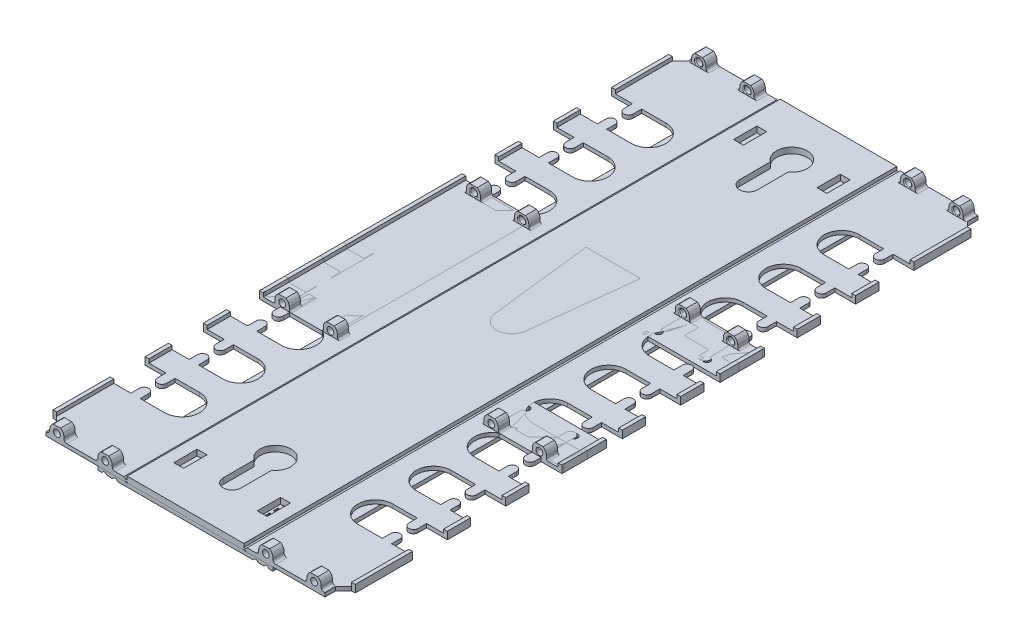
from build123d import *

# Parameters (mm, degrees)
BOSS_EXTRUDE1_DEPTH      = 88.9
SKETCH68_R               = 0.925000055
BOSS_EXTRUDE26_DEPTH     = 3.048
FILLET2_R                = 0.762
FILLET3_R                = 0.254
CUT_EXTRUDE38_DEPTH      = 99.000889576
CUT_EXTRUDE38_DEPTH_BACK = 99.000889576
CUT_EXTRUDE20_DEPTH      = 98.986261425
CUT_EXTRUDE20_DEPTH_BACK = 98.986261425
CUT_EXTRUDE34_DEPTH      = 98.986261425
CUT_EXTRUDE34_DEPTH_BACK = 98.986261425
SKETCH75_R               = 4.191
SKETCH75_W               = 2.6690574
SKETCH75_H               = 6.35
LID_HALF_DEPTH           = 88.9
LID_HALF_DEPTH_BACK      = 88.9
LOGOTEXTSKETCH_W         = 3.793924051
LOGOTEXTSKETCH_H         = 1.221772152
LOGOTEXTSKETCH_W_2       = 0.900253164
LOGOTEXTSKETCH_H_2       = 1.350379746
LOGOTEXTSKETCH_W_3       = 5.272911392
LOGOTEXTSKETCH_H_3       = 1.350379747
CUT_EXTRUDE41_DEPTH      = 0.3048
CUT_EXTRUDE28_DEPTH      = 0.3048
BOSS_EXTRUDE19_DEPTH     = 27.559
SKETCH72_R               = 0.925000055
BOSS_EXTRUDE29_DEPTH     = 3.048
FILLET4_R                = 0.508
FILLET5_R                = 0.254
CUT_EXTRUDE33_DEPTH      = 99.000889576
CUT_EXTRUDE33_DEPTH_BACK = 99.000889576
SKETCH73_R               = 0.925000055
SKETCH73_W               = 29.464
SKETCH73_H               = 30.960000056


with BuildPart() as part:
    # FingerSketch → Boss-Extrude1 (new body)
    with BuildSketch(Plane.XY):
        Polygon((0, 0), (15.748, 0), (15.875, 0.127), (16.383, 0.127), (16.51, 0), (41.148, 0), (41.148, 1.258244922), (41.148, 2.032), (40.132, 2.032), (40.132, 1.016), (16.764, 1.016), (16.383, 0.635), (15.875, 0.635), (15.875, 1.5875), (0, 1.5875), align=None)
    extrude(amount=-BOSS_EXTRUDE1_DEPTH)

    # Sketch68 → Boss-Extrude26 (add)
    # profile 1 of 2: a face of its own
    with BuildSketch(Plane(origin=(0, 0, -88.9), x_dir=(-1, 0, 0), z_dir=(0, 0, -1))):
        with BuildLine():
            Line((-19.939, 1.016), (-19.939, 2.145000028))
            ThreePointArc((-19.939, 2.145000028), (-20.191232451, 3.101841286), (-20.882374721, 3.81))
            Line((-20.882374721, 3.81), (-22.877625389, 3.81))
            ThreePointArc((-22.877625389, 3.81), (-23.568767659, 3.101841286), (-23.82100011, 2.145000028))
            Line((-23.82100011, 2.145000028), (-23.82100011, 1.016))
            Line((-23.82100011, 1.016), (-19.939, 1.016))
        make_face()
        with Locations((-21.880000055, 2.145000028)):
            Circle(SKETCH68_R, mode=Mode.SUBTRACT)
    # profile 2 of 2: a face of its own
    with BuildSketch(Plane(origin=(0, 0, -88.9), x_dir=(-1, 0, 0), z_dir=(0, 0, -1))):
        with BuildLine():
            Line((-34.018374611, 3.81), (-36.013625279, 3.81))
            ThreePointArc((-36.013625279, 3.81), (-36.704767549, 3.101841286), (-36.957, 2.145000028))
            Line((-36.957, 2.145000028), (-36.957, 1.016))
            Line((-36.957, 1.016), (-33.07499989, 1.016))
            Line((-33.07499989, 1.016), (-33.07499989, 2.145000028))
            ThreePointArc((-33.07499989, 2.145000028), (-33.327232341, 3.101841286), (-34.018374611, 3.81))
        make_face()
        with Locations((-35.015999945, 2.145000028)):
            Circle(SKETCH68_R, mode=Mode.SUBTRACT)
    extrude(amount=-BOSS_EXTRUDE26_DEPTH)

    # Fillet2
    fillet2_edges = [part.edges().sort_by_distance(p)[0] for p in [
        (19.939, 1.016, -87.376),
        (23.82100011, 1.016, -87.376),
        (33.07499989, 1.016, -87.376),
        (36.957, 1.016, -87.376),
    ]]
    fillet(fillet2_edges, radius=FILLET2_R)

    # Fillet3
    fillet3_edges = [part.edges().sort_by_distance(p)[0] for p in [
        (22.80500011, 2.145000028, -85.852),
        (35.941, 2.145000028, -85.852),
    ]]
    fillet(fillet3_edges, radius=FILLET3_R)

    # Sketch79 → Cut-Extrude38 (cut, two sides: drawn at the far end of the back side and taken through both)
    with BuildSketch(Plane(origin=(0, 1.016, 0), x_dir=(1, 0, 0), z_dir=(0, 1, 0)).offset(-CUT_EXTRUDE38_DEPTH_BACK)):
        Polygon((37.973, 85.979), (40.132, 83.82), (41.148, 83.82), (41.148, 88.9), (37.973, 88.9), align=None)
    extrude(amount=CUT_EXTRUDE38_DEPTH + CUT_EXTRUDE38_DEPTH_BACK, mode=Mode.SUBTRACT)

    # Sketch4 → Cut-Extrude20 (cut, two sides: drawn at the far end of the back side and taken through both)
    with BuildSketch(Plane(origin=(0, 1.5875, 0), x_dir=(1, 0, 0), z_dir=(0, 1, 0)).offset(-CUT_EXTRUDE20_DEPTH_BACK)):
        with BuildLine():
            Line((26.289, 4.7625), (32.9565, 4.7625))
            Line((32.9565, 4.7625), (32.9565, 2.460625))
            ThreePointArc((32.9565, 2.460625), (34.2265, 1.190625), (35.4965, 2.460625))
            Line((35.4965, 2.460625), (35.4965, 4.7625))
            Line((35.4965, 4.7625), (77.089, 4.7625))
            Line((77.089, 4.7625), (77.089, -4.7625))
            Line((77.089, -4.7625), (35.4965, -4.7625))
            Line((35.4965, -4.7625), (35.4965, -2.460625))
            ThreePointArc((35.4965, -2.460625), (34.2265, -1.190625), (32.9565, -2.460625))
            Line((32.9565, -2.460625), (32.9565, -4.7625))
            Line((32.9565, -4.7625), (26.289, -4.7625))
            ThreePointArc((26.289, -4.7625), (21.5265, 0), (26.289, 4.7625))
        make_face()
        with BuildLine():
            Line((26.289, 20.6375), (32.9565, 20.6375))
            Line((32.9565, 20.6375), (32.9565, 18.335625))
            ThreePointArc((32.9565, 18.335625), (34.2265, 17.065625), (35.4965, 18.335625))
            Line((35.4965, 18.335625), (35.4965, 20.6375))
            Line((35.4965, 20.6375), (77.089, 20.6375))
            Line((77.089, 20.6375), (77.089, 11.1125))
            Line((77.089, 11.1125), (35.4965, 11.1125))
            Line((35.4965, 11.1125), (35.4965, 13.414375))
            ThreePointArc((35.4965, 13.414375), (34.2265, 14.684375), (32.9565, 13.414375))
            Line((32.9565, 13.414375), (32.9565, 11.1125))
            Line((32.9565, 11.1125), (26.289, 11.1125))
            ThreePointArc((26.289, 11.1125), (21.5265, 15.875), (26.289, 20.6375))
        make_face()
        with BuildLine():
            Line((26.289, 36.5125), (32.9565, 36.5125))
            Line((32.9565, 36.5125), (32.9565, 34.210625))
            ThreePointArc((32.9565, 34.210625), (34.2265, 32.940625), (35.4965, 34.210625))
            Line((35.4965, 34.210625), (35.4965, 36.5125))
            Line((35.4965, 36.5125), (77.089, 36.5125))
            Line((77.089, 36.5125), (77.089, 26.9875))
            Line((77.089, 26.9875), (35.4965, 26.9875))
            Line((35.4965, 26.9875), (35.4965, 29.289375))
            ThreePointArc((35.4965, 29.289375), (34.2265, 30.559375), (32.9565, 29.289375))
            Line((32.9565, 29.289375), (32.9565, 26.9875))
            Line((32.9565, 26.9875), (26.289, 26.9875))
            ThreePointArc((26.289, 26.9875), (21.5265, 31.75), (26.289, 36.5125))
        make_face()
        with BuildLine():
            Line((26.289, 52.3875), (32.9565, 52.3875))
            Line((32.9565, 52.3875), (32.9565, 50.085625))
            ThreePointArc((32.9565, 50.085625), (34.2265, 48.815625), (35.4965, 50.085625))
            Line((35.4965, 50.085625), (35.4965, 52.3875))
            Line((35.4965, 52.3875), (77.089, 52.3875))
            Line((77.089, 52.3875), (77.089, 42.8625))
            Line((77.089, 42.8625), (35.4965, 42.8625))
            Line((35.4965, 42.8625), (35.4965, 45.164375))
            ThreePointArc((35.4965, 45.164375), (34.2265, 46.434375), (32.9565, 45.164375))
            Line((32.9565, 45.164375), (32.9565, 42.8625))
            Line((32.9565, 42.8625), (26.289, 42.8625))
            ThreePointArc((26.289, 42.8625), (21.5265, 47.625), (26.289, 52.3875))
        make_face()
        with BuildLine():
            Line((26.289, 68.2625), (32.9565, 68.2625))
            Line((32.9565, 68.2625), (32.9565, 65.960625))
            ThreePointArc((32.9565, 65.960625), (34.2265, 64.690625), (35.4965, 65.960625))
            Line((35.4965, 65.960625), (35.4965, 68.2625))
            Line((35.4965, 68.2625), (77.089, 68.2625))
            Line((77.089, 68.2625), (77.089, 58.7375))
            Line((77.089, 58.7375), (35.4965, 58.7375))
            Line((35.4965, 58.7375), (35.4965, 61.039375))
            ThreePointArc((35.4965, 61.039375), (34.2265, 62.309375), (32.9565, 61.039375))
            Line((32.9565, 61.039375), (32.9565, 58.7375))
            Line((32.9565, 58.7375), (26.289, 58.7375))
            ThreePointArc((26.289, 58.7375), (21.5265, 63.5), (26.289, 68.2625))
        make_face()
    extrude(amount=CUT_EXTRUDE20_DEPTH + CUT_EXTRUDE20_DEPTH_BACK, mode=Mode.SUBTRACT)

    # Mirror31: part across plane


with BuildPart() as part_1:
    add(part.part)
    add(part.part.mirror(Plane.XY))

    # Mirror32: part across plane


with BuildPart() as part_2:
    add(part_1.part)
    add(part_1.part.mirror(Plane(origin=(0, 1.5875, -88.9), x_dir=(0, 0, 1), z_dir=(-1, 0, 0))))

    # Sketch75 → Cut-Extrude34 (cut, two sides: drawn at the far end of the back side and taken through both)
    with BuildSketch(Plane(origin=(0, 1.5875, 0), x_dir=(1, 0, 0), z_dir=(0, 1, 0)).offset(-CUT_EXTRUDE34_DEPTH_BACK)):
        Circle(SKETCH75_R)
        with BuildLine():
            Line((2.413, -76.2), (2.413, -67.818))
            ThreePointArc((2.413, -67.818), (0, -60.200352659), (-2.413, -67.818))
            Line((-2.413, -67.818), (-2.413, -76.2))
            ThreePointArc((-2.413, -76.2), (0, -78.613), (2.413, -76.2))
        make_face()
        with BuildLine():
            Line((2.413, 64.391352659), (2.413, 72.773352659))
            ThreePointArc((2.413, 72.773352659), (0, 80.391), (-2.413, 72.773352659))
            Line((-2.413, 72.773352659), (-2.413, 64.391352659))
            ThreePointArc((-2.413, 64.391352659), (0, 61.978352659), (2.413, 64.391352659))
        make_face()
        with Locations((-11.3654713, 76.2)):
            Rectangle(SKETCH75_W, SKETCH75_H)
        with Locations((11.3654713, 76.2)):
            Rectangle(SKETCH75_W, SKETCH75_H)
        with Locations((11.3654713, -76.2)):
            Rectangle(SKETCH75_W, SKETCH75_H)
        with Locations((-11.3654713, -76.2)):
            Rectangle(SKETCH75_W, SKETCH75_H)
    extrude(amount=CUT_EXTRUDE34_DEPTH + CUT_EXTRUDE34_DEPTH_BACK, mode=Mode.SUBTRACT)


with BuildPart() as body_2:
    # LidSketch → Lid-Half (new, two sides: drawn at the far end of the back side and taken through both)
    with BuildSketch(Plane.XY.offset(-LID_HALF_DEPTH_BACK)):
        Polygon((0, 0), (23.7998, 0), (23.7998, -1.016), (22.7838, -1.016), (22.2758, -0.508), (21.8694, -0.508), (21.3614, -1.016), (19.8374, -1.016), (19.3294, -0.508), (18.923, -0.508), (18.415, -1.016), (0, -1.016), align=None)
    extrude(amount=LID_HALF_DEPTH + LID_HALF_DEPTH_BACK)

    # Mirror25: body 2 across plane


with BuildPart() as body_2_1:
    add(body_2.part)
    add(body_2.part.mirror(Plane(origin=(0, -1.016, -88.9), x_dir=(0, 0, 1), z_dir=(-1, 0, 0))))

    # LogoTextSketch → Cut-Extrude41 (cut)
    # profile 1 of 14: a face of its own
    with BuildSketch(Plane(origin=(0, 0, 0), x_dir=(1, 0, 0), z_dir=(0, 1, 0))):
        Polygon((10.795, -78.611392405), (15.875, -80.454098101), (15.875, -81.912990506), (10.795, -83.755696203), (10.795, -82.387231013), (14.40806962, -81.149382911), (10.795, -79.91153481), align=None)
    # profile 2 of 14: a face of its own
    with BuildSketch(Plane(origin=(0, 0, 0), x_dir=(1, 0, 0), z_dir=(0, 1, 0))):
        with Locations((13.978037975, -77.293164557)):
            Rectangle(LOGOTEXTSKETCH_W, LOGOTEXTSKETCH_H)
    # profile 3 of 14: a face of its own
    with BuildSketch(Plane(origin=(0, 0, 0), x_dir=(1, 0, 0), z_dir=(0, 1, 0))):
        with Locations((11.05221519, -77.293164557)):
            Rectangle(LOGOTEXTSKETCH_W_2, LOGOTEXTSKETCH_H_2)
    # profile 4 of 14: a face of its own
    with BuildSketch(Plane(origin=(0, 0, 0), x_dir=(1, 0, 0), z_dir=(0, 1, 0))):
        with Locations((13.238544304, -74.913924051)):
            Rectangle(LOGOTEXTSKETCH_W_3, LOGOTEXTSKETCH_H)
    # profile 5 of 14: a face of its own
    with BuildSketch(Plane(origin=(0, 0, 0), x_dir=(1, 0, 0), z_dir=(0, 1, 0))):
        with Locations((13.238544304, -72.534683544)):
            Rectangle(LOGOTEXTSKETCH_W_3, LOGOTEXTSKETCH_H)
    # profile 6 of 14: a face of its own
    with BuildSketch(Plane(origin=(0, 0, 0), x_dir=(1, 0, 0), z_dir=(0, 1, 0))):
        with BuildLine():
            add(Edge.make_bspline(
                [(15.471091772, -68.451392405), (15.498614467, -68.487858085), (15.559190151, -68.568116703), (15.652438813, -68.694367961), (15.745244088, -68.827171113), (15.794508188, -68.922087513), (15.81772943, -68.966827532)],
                knots=[0, 0, 0, 0, 0.881141738, 1.939336363, 3.028680722, 4, 4, 4, 4], degree=3))
            add(Edge.make_bspline(
                [(15.81772943, -68.966827532), (15.845233424, -69.026555013), (15.90032134, -69.146183549), (15.948607766, -69.30474509), (15.976485245, -69.435869622), (15.993100434, -69.538723702), (16.001874183, -69.646550388), (16.003021663, -69.720038483), (16.003607595, -69.757563291)],
                knots=[0, 0, 0, 0, 1.44279282, 2.889778507, 3.626899602, 4.386250432, 5.175980226, 6, 6, 6, 6], degree=3))
            add(Edge.make_bspline(
                [(16.003607595, -69.757563291), (16.002750455, -69.801488718), (16.001062874, -69.887971309), (15.984492599, -70.015107561), (15.957718476, -70.136573074), (15.919709208, -70.252356945), (15.873298304, -70.363548759), (15.812880868, -70.468116032), (15.743749724, -70.568019165), (15.664302339, -70.660827732), (15.577987714, -70.746673503), (15.482419999, -70.819399629), (15.383364601, -70.884197416), (15.276241026, -70.933800305), (15.16462257, -70.974917076), (15.046458559, -71.002314607), (14.92270707, -71.020141499), (14.838166185, -71.022392311), (14.794897152, -71.023544304)],
                knots=[0, 0, 0, 0, 1.076358544, 2.119188901, 3.137092131, 4.121153932, 5.103295744, 6.085025642, 7.075812122, 8.077694892, 9.076342729, 10.053530105, 11.016996406, 11.971853096, 12.940587616, 13.928341713, 14.939700582, 16, 16, 16, 16], degree=3))
            add(Edge.make_bspline(
                [(14.794897152, -71.023544304), (14.760375748, -71.023031806), (14.693218098, -71.022034797), (14.594971407, -71.012359162), (14.501240594, -70.998730988), (14.41213198, -70.978912894), (14.327828842, -70.952525931), (14.248670006, -70.920321), (14.173700942, -70.883331881), (14.081031733, -70.82520985), (13.974702488, -70.738319051), (13.86105285, -70.615301335), (13.761884983, -70.472730962), (13.709459895, -70.367181159), (13.682642405, -70.313188291)],
                knots=[0, 0, 0, 0, 0.88291446, 1.717614387, 2.523449501, 3.305050364, 4.050299936, 4.780623104, 5.489521503, 6.186144807, 7.575169446, 8.987908457, 10.459196939, 12, 12, 12, 12], degree=3))
            add(Edge.make_bspline(
                [(13.682642405, -70.313188291), (13.657799828, -70.253964254), (13.60626134, -70.131097879), (13.547208407, -69.931294794), (13.498036942, -69.712086301), (13.448977132, -69.38991438), (13.403708541, -68.965281802), (13.379473663, -68.619941112), (13.367151899, -68.444359177)],
                knots=[0, 0, 0, 0, 0.606561714, 1.258374848, 1.96559256, 2.728439316, 4.336636913, 6, 6, 6, 6], degree=3))
            Line((13.367151899, -68.444359177), (13.347056962, -68.444359177))
            add(Edge.make_bspline(
                [(13.347056962, -68.444359177), (13.32154498, -68.445039977), (13.272555629, -68.446347282), (13.202031393, -68.458886832), (13.137492648, -68.478381742), (13.079152372, -68.507367456), (13.026345234, -68.543228865), (12.980747868, -68.588843825), (12.939990884, -68.641032252), (12.907124676, -68.702613035), (12.879273701, -68.771187237), (12.855546056, -68.846968902), (12.833983175, -68.92999437), (12.81748491, -69.021042615), (12.804386314, -69.119621265), (12.795845742, -69.225606143), (12.789386844, -69.339175159), (12.788747908, -69.417613589), (12.788417722, -69.458148734)],
                knots=[0, 0, 0, 0, 0.933170865, 1.791920174, 2.614087183, 3.392770743, 4.168261972, 4.939963421, 5.744383729, 6.584011918, 7.485718493, 8.451275145, 9.489173902, 10.624282219, 11.836444718, 13.128632794, 14.516144596, 16, 16, 16, 16], degree=3))
            add(Edge.make_bspline(
                [(12.788417722, -69.458148734), (12.789575831, -69.509109483), (12.791945495, -69.613382707), (12.811939061, -69.77194583), (12.84462443, -69.935569553), (12.887872377, -70.098812379), (12.935830948, -70.251548952), (12.976523722, -70.386216582), (13.01243626, -70.496407428), (13.035483295, -70.561730835), (13.045632911, -70.590498418)],
                knots=[0, 0, 0, 0, 1.048023305, 2.144410588, 3.282079539, 4.478558128, 5.616227078, 6.575084586, 7.372485689, 8, 8, 8, 8], degree=3))
            Line((13.045632911, -70.590498418), (13.045632911, -70.702025316))
            Line((13.045632911, -70.702025316), (12.139351266, -70.702025316))
            add(Edge.make_bspline(
                [(12.139351266, -70.702025316), (12.130387793, -70.664570531), (12.110217608, -70.580287348), (12.082929968, -70.437652176), (12.051709585, -70.265231856), (12.019368047, -70.067401376), (11.988834071, -69.854249993), (11.968569783, -69.635609752), (11.954466255, -69.416805036), (11.953134981, -69.270953527), (11.952468354, -69.197919304)],
                knots=[0, 0, 0, 0, 0.6084796, 1.369240178, 2.294152062, 3.377333042, 4.536647214, 5.695671455, 6.846122025, 8, 8, 8, 8], degree=3))
            add(Edge.make_bspline(
                [(11.952468354, -69.197919304), (11.953370641, -69.114167135), (11.95511543, -68.952211997), (11.970161702, -68.718469188), (11.994857066, -68.502754811), (12.029412156, -68.3052476), (12.074881809, -68.125749205), (12.12774632, -67.963215463), (12.193399083, -67.819449208), (12.269037916, -67.692877861), (12.356608344, -67.583132604), (12.454433097, -67.487654992), (12.564506967, -67.40743234), (12.685770341, -67.34177726), (12.818759838, -67.291633979), (12.962697977, -67.25568361), (13.117930472, -67.233074594), (13.225401959, -67.230794416), (13.280743671, -67.229620253)],
                knots=[0, 0, 0, 0, 1.479899489, 2.861744692, 4.136898628, 5.315257758, 6.401879285, 7.406912486, 8.331189956, 9.188870103, 10.005954314, 10.805378538, 11.597319, 12.405025375, 13.234891758, 14.101894016, 15.022583225, 16, 16, 16, 16], degree=3))
            Line((13.280743671, -67.229620253), (15.875, -67.229620253))
            Line((15.875, -67.229620253), (15.875, -68.451392405))
            Line((15.875, -68.451392405), (15.471091772, -68.451392405))
        make_face()
        with BuildLine():
            Line((14.889343354, -68.451392405), (14.074493671, -68.451392405))
            add(Edge.make_bspline(
                [(14.074493671, -68.451392405), (14.082584256, -68.537495036), (14.099411798, -68.716579207), (14.125104728, -68.940646483), (14.148965673, -69.117949351), (14.170386107, -69.235794696), (14.191595528, -69.336605887), (14.209148421, -69.397274657), (14.217167722, -69.424992089)],
                knots=[0, 0, 0, 0, 1.57964772, 3.285496648, 4.119513749, 4.84671241, 5.47310339, 6, 6, 6, 6], degree=3))
            add(Edge.make_bspline(
                [(14.217167722, -69.424992089), (14.22754035, -69.454079193), (14.247432046, -69.50985983), (14.287168287, -69.586234004), (14.332927957, -69.652335841), (14.387300974, -69.706825272), (14.449605162, -69.750205249), (14.521165001, -69.780154192), (14.601371539, -69.798845047), (14.657805004, -69.800765427), (14.687389241, -69.801772152)],
                knots=[0, 0, 0, 0, 1.134226965, 2.175118677, 3.155630695, 4.078552511, 4.990484312, 5.928236403, 6.913914931, 8, 8, 8, 8], degree=3))
            add(Edge.make_bspline(
                [(14.687389241, -69.801772152), (14.724243766, -69.800843371), (14.790646432, -69.799169941), (14.884702408, -69.786485888), (14.967988261, -69.747352454), (15.009615514, -69.703039989), (15.032017405, -69.679193038)],
                knots=[0, 0, 0, 0, 1.163598059, 2.096513573, 2.975630291, 4, 4, 4, 4], degree=3))
            add(Edge.make_bspline(
                [(15.032017405, -69.679193038), (15.053410379, -69.651548475), (15.097104887, -69.595085284), (15.132764622, -69.508348872), (15.150190808, -69.426478405), (15.161328766, -69.348970773), (15.166592869, -69.256266747), (15.167285919, -69.189550629), (15.167658228, -69.153710443)],
                knots=[0, 0, 0, 0, 1.128733193, 2.305403657, 2.994957252, 3.838787388, 4.838987289, 6, 6, 6, 6], degree=3))
            add(Edge.make_bspline(
                [(15.167658228, -69.153710443), (15.16658297, -69.123185725), (15.164409779, -69.061492598), (15.149929517, -68.968514057), (15.125533307, -68.875146915), (15.09246664, -68.782068526), (15.051348527, -68.691596782), (15.004843589, -68.604839303), (14.94986926, -68.52520931), (14.909444264, -68.475907312), (14.889343354, -68.451392405)],
                knots=[0, 0, 0, 0, 0.950493584, 1.921030753, 2.922727847, 3.951900201, 4.992842113, 6.014962171, 7.012960544, 8, 8, 8, 8], degree=3))
        make_face(mode=Mode.SUBTRACT)
    # profile 7 of 14: a face of its own
    with BuildSketch(Plane(origin=(0, 0, 0), x_dir=(1, 0, 0), z_dir=(0, 1, 0))):
        with Locations((13.978037975, -65.52556962)):
            Rectangle(LOGOTEXTSKETCH_W, LOGOTEXTSKETCH_H)
    # profile 8 of 14: a face of its own
    with BuildSketch(Plane(origin=(0, 0, 0), x_dir=(1, 0, 0), z_dir=(0, 1, 0))):
        with Locations((11.05221519, -65.525569621)):
            Rectangle(LOGOTEXTSKETCH_W_2, LOGOTEXTSKETCH_H_3)
    # profile 9 of 14: a face of its own
    with BuildSketch(Plane(origin=(0, 0, 0), x_dir=(1, 0, 0), z_dir=(0, 1, 0))):
        with BuildLine():
            Line((15.875, -59.898987342), (15.875, -61.120759494))
            Line((15.875, -61.120759494), (13.965981013, -61.120759494))
            add(Edge.make_bspline(
                [(13.965981013, -61.120759494), (13.888235537, -61.121816671), (13.732844249, -61.123929671), (13.541968245, -61.140602547), (13.397336807, -61.15784772), (13.304385455, -61.1768854), (13.225730941, -61.198746772), (13.180735364, -61.219698148), (13.160174051, -61.229272152)],
                knots=[0, 0, 0, 0, 1.709225407, 3.416259723, 4.21101956, 4.910102269, 5.501957085, 6, 6, 6, 6], degree=3))
            add(Edge.make_bspline(
                [(13.160174051, -61.229272152), (13.139948946, -61.241689023), (13.100294779, -61.266034049), (13.048891025, -61.313676427), (13.006384431, -61.369380938), (12.972711718, -61.434360935), (12.947595805, -61.509625525), (12.930004677, -61.596992892), (12.919223732, -61.697553211), (12.917786083, -61.769126718), (12.917025316, -61.807001582)],
                knots=[0, 0, 0, 0, 0.860284341, 1.686708632, 2.528476982, 3.393563585, 4.332150703, 5.400907339, 6.624626855, 8, 8, 8, 8], degree=3))
            add(Edge.make_bspline(
                [(12.917025316, -61.807001582), (12.920070517, -61.864454174), (12.926284562, -61.981692115), (12.960256201, -62.127712304), (13.003600251, -62.245245017), (13.042508722, -62.339264981), (13.091139534, -62.436578219), (13.128055441, -62.501782817), (13.147112342, -62.535443038)],
                knots=[0, 0, 0, 0, 1.338233385, 2.730803257, 3.468495571, 4.255080394, 5.099229486, 6, 6, 6, 6], degree=3))
            Line((13.147112342, -62.535443038), (15.875, -62.535443038))
            Line((15.875, -62.535443038), (15.875, -63.75721519))
            Line((15.875, -63.75721519), (12.081075949, -63.75721519))
            Line((12.081075949, -63.75721519), (12.081075949, -62.535443038))
            Line((12.081075949, -62.535443038), (12.478955696, -62.535443038))
            add(Edge.make_bspline(
                [(12.478955696, -62.535443038), (12.437988659, -62.481735376), (12.358243885, -62.377190218), (12.25494667, -62.215811194), (12.163005962, -62.059819035), (12.086189543, -61.904649327), (12.025300659, -61.745924841), (11.983868023, -61.579929192), (11.95628625, -61.406360199), (11.95375581, -61.287657219), (11.952468354, -61.227262658)],
                knots=[0, 0, 0, 0, 1.126064518, 2.191951536, 3.19307265, 4.144813015, 5.076393104, 6.021983703, 6.993610568, 8, 8, 8, 8], degree=3))
            add(Edge.make_bspline(
                [(11.952468354, -61.227262658), (11.953758693, -61.176652396), (11.956277665, -61.07785216), (11.972002901, -60.93384181), (12.000005032, -60.798149611), (12.040434528, -60.671485648), (12.09079563, -60.552832957), (12.151957563, -60.4424098), (12.226293062, -60.341530941), (12.310614875, -60.248652289), (12.406704479, -60.165418348), (12.514831821, -60.09433075), (12.633830175, -60.033580434), (12.763347031, -59.983424643), (12.904518094, -59.945271863), (13.056581834, -59.919049735), (13.219695424, -59.901052432), (13.332268528, -59.899689475), (13.390261076, -59.898987342)],
                knots=[0, 0, 0, 0, 1.088244909, 2.124447647, 3.110254678, 4.062235362, 4.978491991, 5.877983887, 6.769571508, 7.666696544, 8.570415953, 9.495151274, 10.442024977, 11.43832337, 12.476026402, 13.580659577, 14.753665747, 16, 16, 16, 16], degree=3))
            Line((13.390261076, -59.898987342), (15.875, -59.898987342))
        make_face()
    # profile 10 of 14: a face of its own
    with BuildSketch(Plane(origin=(0, 0, 0), x_dir=(1, 0, 0), z_dir=(0, 1, 0))):
        Polygon((11.759556962, -54.754683544), (11.759556962, -56.362278481), (15.875, -56.362278481), (15.875, -57.64835443), (11.759556962, -57.64835443), (11.759556962, -59.255949367), (10.795, -59.255949367), (10.795, -54.754683544), align=None)
    # profile 11 of 14: a face of its own
    with BuildSketch(Plane(origin=(0, 0, 0), x_dir=(1, 0, 0), z_dir=(0, 1, 0))):
        with BuildLine():
            Line((13.238544304, -51.282278481), (13.238544304, -51.390791139))
            add(Edge.make_bspline(
                [(13.238544304, -51.390791139), (13.233210996, -51.405772057), (13.221304267, -51.439217289), (13.209292377, -51.496645943), (13.198074294, -51.565681227), (13.190054363, -51.643234312), (13.183171335, -51.723301822), (13.178199118, -51.799010916), (13.174909335, -51.867681945), (13.174455171, -51.910911896), (13.174240506, -51.931344937)],
                knots=[0, 0, 0, 0, 0.697795818, 1.557844694, 2.571184754, 3.770094633, 4.980769819, 6.101209641, 7.102518949, 8, 8, 8, 8], degree=3))
            add(Edge.make_bspline(
                [(13.174240506, -51.931344937), (13.174468051, -51.973894643), (13.174909149, -52.056377727), (13.182792921, -52.175943322), (13.191933393, -52.288046866), (13.212744507, -52.430139917), (13.252880472, -52.610149875), (13.29954394, -52.751596511), (13.323947785, -52.82556962)],
                knots=[0, 0, 0, 0, 0.839984125, 1.628318657, 2.365359903, 3.06025255, 4.46258444, 6, 6, 6, 6], degree=3))
            Line((13.323947785, -52.82556962), (15.875, -52.82556962))
            Line((15.875, -52.82556962), (15.875, -54.047341772))
            Line((15.875, -54.047341772), (12.081075949, -54.047341772))
            Line((12.081075949, -54.047341772), (12.081075949, -52.82556962))
            Line((12.081075949, -52.82556962), (12.640719937, -52.82556962))
            add(Edge.make_bspline(
                [(12.640719937, -52.82556962), (12.612663312, -52.792624114), (12.558149794, -52.728611589), (12.483176658, -52.632099846), (12.414924945, -52.539314256), (12.355651, -52.449150872), (12.300956595, -52.36370117), (12.2565275, -52.280206605), (12.21735878, -52.200949229), (12.178343683, -52.100145919), (12.140521747, -51.978981608), (12.106981048, -51.838025027), (12.085664201, -51.702908121), (12.082576903, -51.614585442), (12.081075949, -51.57164557)],
                knots=[0, 0, 0, 0, 1.109295407, 2.155341036, 3.132587773, 4.061365897, 4.921480051, 5.732171069, 6.484904115, 7.186484132, 8.500872557, 9.735934661, 10.899278438, 12, 12, 12, 12], degree=3))
            add(Edge.make_bspline(
                [(12.081075949, -51.57164557), (12.081402049, -51.548537612), (12.082092142, -51.499636526), (12.083322366, -51.425205913), (12.088859211, -51.351919013), (12.092462337, -51.304381624), (12.094137658, -51.282278481)],
                knots=[0, 0, 0, 0, 0.957149017, 2.025519883, 3.081939105, 4, 4, 4, 4], degree=3))
            Line((12.094137658, -51.282278481), (13.238544304, -51.282278481))
        make_face()
    # profile 12 of 14: a face of its own
    with BuildSketch(Plane(origin=(0, 0, 0), x_dir=(1, 0, 0), z_dir=(0, 1, 0))):
        with BuildLine():
            add(Edge.make_bspline(
                [(15.471091772, -48.26), (15.498614467, -48.29646568), (15.559190151, -48.376724298), (15.652438813, -48.502975556), (15.745244088, -48.635778708), (15.794508188, -48.730695108), (15.81772943, -48.775435127)],
                knots=[0, 0, 0, 0, 0.881141738, 1.939336363, 3.028680722, 4, 4, 4, 4], degree=3))
            add(Edge.make_bspline(
                [(15.81772943, -48.775435127), (15.845233424, -48.835162608), (15.90032134, -48.954791144), (15.948607766, -49.113352684), (15.976485245, -49.244477216), (15.993100434, -49.347331297), (16.001874183, -49.455157983), (16.003021663, -49.528646078), (16.003607595, -49.566170886)],
                knots=[0, 0, 0, 0, 1.44279282, 2.889778507, 3.626899602, 4.386250432, 5.175980226, 6, 6, 6, 6], degree=3))
            add(Edge.make_bspline(
                [(16.003607595, -49.566170886), (16.002750455, -49.610096313), (16.001062874, -49.696578904), (15.984492599, -49.823715156), (15.957718476, -49.945180669), (15.919709208, -50.06096454), (15.873298304, -50.172156354), (15.812880868, -50.276723627), (15.743749724, -50.37662676), (15.664302339, -50.469435327), (15.577987714, -50.555281098), (15.482419999, -50.628007224), (15.383364601, -50.69280501), (15.276241026, -50.7424079), (15.16462257, -50.783524671), (15.046458559, -50.810922202), (14.92270707, -50.828749094), (14.838166185, -50.830999906), (14.794897152, -50.832151899)],
                knots=[0, 0, 0, 0, 1.076358544, 2.119188901, 3.137092131, 4.121153932, 5.103295744, 6.085025642, 7.075812122, 8.077694892, 9.076342729, 10.053530105, 11.016996406, 11.971853096, 12.940587616, 13.928341713, 14.939700582, 16, 16, 16, 16], degree=3))
            add(Edge.make_bspline(
                [(14.794897152, -50.832151899), (14.760375748, -50.831639401), (14.693218098, -50.830642392), (14.594971407, -50.820966757), (14.501240594, -50.807338582), (14.41213198, -50.787520489), (14.327828842, -50.761133525), (14.248670006, -50.728928595), (14.173700942, -50.691939476), (14.081031733, -50.633817445), (13.974702488, -50.546926646), (13.86105285, -50.423908929), (13.761884983, -50.281338557), (13.709459895, -50.175788754), (13.682642405, -50.121795886)],
                knots=[0, 0, 0, 0, 0.88291446, 1.717614387, 2.523449501, 3.305050364, 4.050299936, 4.780623104, 5.489521503, 6.186144807, 7.575169446, 8.987908457, 10.459196939, 12, 12, 12, 12], degree=3))
            add(Edge.make_bspline(
                [(13.682642405, -50.121795886), (13.657799828, -50.062571849), (13.60626134, -49.939705474), (13.547208407, -49.739902389), (13.498036942, -49.520693896), (13.448977132, -49.198521975), (13.403708541, -48.773889397), (13.379473663, -48.428548707), (13.367151899, -48.252966772)],
                knots=[0, 0, 0, 0, 0.606561714, 1.258374848, 1.96559256, 2.728439316, 4.336636913, 6, 6, 6, 6], degree=3))
            Line((13.367151899, -48.252966772), (13.347056962, -48.252966772))
            add(Edge.make_bspline(
                [(13.347056962, -48.252966772), (13.32154498, -48.253647572), (13.272555629, -48.254954877), (13.202031393, -48.267494427), (13.137492648, -48.286989337), (13.079152372, -48.315975051), (13.026345234, -48.35183646), (12.980747868, -48.39745142), (12.939990884, -48.449639847), (12.907124676, -48.51122063), (12.879273701, -48.579794832), (12.855546056, -48.655576497), (12.833983175, -48.738601965), (12.81748491, -48.82965021), (12.804386314, -48.92822886), (12.795845742, -49.034213738), (12.789386844, -49.147782754), (12.788747908, -49.226221184), (12.788417722, -49.266756329)],
                knots=[0, 0, 0, 0, 0.933170865, 1.791920174, 2.614087183, 3.392770743, 4.168261972, 4.939963421, 5.744383729, 6.584011918, 7.485718493, 8.451275145, 9.489173902, 10.624282219, 11.836444718, 13.128632794, 14.516144596, 16, 16, 16, 16], degree=3))
            add(Edge.make_bspline(
                [(12.788417722, -49.266756329), (12.789575831, -49.317717078), (12.791945495, -49.421990302), (12.811939061, -49.580553424), (12.84462443, -49.744177148), (12.887872377, -49.907419974), (12.935830948, -50.060156547), (12.976523722, -50.194824177), (13.01243626, -50.305015023), (13.035483295, -50.37033843), (13.045632911, -50.399106013)],
                knots=[0, 0, 0, 0, 1.048023305, 2.144410588, 3.282079539, 4.478558128, 5.616227078, 6.575084586, 7.372485689, 8, 8, 8, 8], degree=3))
            Line((13.045632911, -50.399106013), (13.045632911, -50.510632911))
            Line((13.045632911, -50.510632911), (12.139351266, -50.510632911))
            add(Edge.make_bspline(
                [(12.139351266, -50.510632911), (12.130387793, -50.473178126), (12.110217608, -50.388894943), (12.082929968, -50.246259771), (12.051709585, -50.073839451), (12.019368047, -49.876008971), (11.988834071, -49.662857588), (11.968569783, -49.444217347), (11.954466255, -49.225412631), (11.953134981, -49.079561122), (11.952468354, -49.006526899)],
                knots=[0, 0, 0, 0, 0.6084796, 1.369240178, 2.294152062, 3.377333042, 4.536647214, 5.695671455, 6.846122025, 8, 8, 8, 8], degree=3))
            add(Edge.make_bspline(
                [(11.952468354, -49.006526899), (11.953370641, -48.922774729), (11.95511543, -48.760819592), (11.970161702, -48.527076783), (11.994857066, -48.311362406), (12.029412156, -48.113855195), (12.074881809, -47.934356799), (12.12774632, -47.771823058), (12.193399083, -47.628056803), (12.269037916, -47.501485456), (12.356608344, -47.391740199), (12.454433097, -47.296262587), (12.564506967, -47.216039935), (12.685770341, -47.150384855), (12.818759838, -47.100241574), (12.962697977, -47.064291205), (13.117930472, -47.041682189), (13.225401959, -47.03940201), (13.280743671, -47.038227848)],
                knots=[0, 0, 0, 0, 1.479899489, 2.861744692, 4.136898628, 5.315257758, 6.401879285, 7.406912486, 8.331189956, 9.188870103, 10.005954314, 10.805378538, 11.597319, 12.405025375, 13.234891758, 14.101894016, 15.022583225, 16, 16, 16, 16], degree=3))
            Line((13.280743671, -47.038227848), (15.875, -47.038227848))
            Line((15.875, -47.038227848), (15.875, -48.26))
            Line((15.875, -48.26), (15.471091772, -48.26))
        make_face()
        with BuildLine():
            Line((14.889343354, -48.26), (14.074493671, -48.26))
            add(Edge.make_bspline(
                [(14.074493671, -48.26), (14.082584256, -48.34610263), (14.099411798, -48.525186802), (14.125104728, -48.749254078), (14.148965673, -48.926556946), (14.170386107, -49.044402291), (14.191595528, -49.145213481), (14.209148421, -49.205882252), (14.217167722, -49.233599684)],
                knots=[0, 0, 0, 0, 1.57964772, 3.285496648, 4.119513749, 4.84671241, 5.47310339, 6, 6, 6, 6], degree=3))
            add(Edge.make_bspline(
                [(14.217167722, -49.233599684), (14.22754035, -49.262686788), (14.247432046, -49.318467425), (14.287168287, -49.394841599), (14.332927957, -49.460943435), (14.387300974, -49.515432867), (14.449605162, -49.558812844), (14.521165001, -49.588761786), (14.601371539, -49.607452641), (14.657805004, -49.609373022), (14.687389241, -49.610379747)],
                knots=[0, 0, 0, 0, 1.134226965, 2.175118677, 3.155630695, 4.078552511, 4.990484312, 5.928236403, 6.913914931, 8, 8, 8, 8], degree=3))
            add(Edge.make_bspline(
                [(14.687389241, -49.610379747), (14.724243766, -49.609450966), (14.790646432, -49.607777536), (14.884702408, -49.595093483), (14.967988261, -49.555960049), (15.009615514, -49.511647584), (15.032017405, -49.487800633)],
                knots=[0, 0, 0, 0, 1.163598059, 2.096513573, 2.975630291, 4, 4, 4, 4], degree=3))
            add(Edge.make_bspline(
                [(15.032017405, -49.487800633), (15.053410379, -49.460156069), (15.097104887, -49.403692879), (15.132764622, -49.316956467), (15.150190808, -49.235086), (15.161328766, -49.157578368), (15.166592869, -49.064874342), (15.167285919, -48.998158224), (15.167658228, -48.962318038)],
                knots=[0, 0, 0, 0, 1.128733193, 2.305403657, 2.994957252, 3.838787388, 4.838987289, 6, 6, 6, 6], degree=3))
            add(Edge.make_bspline(
                [(15.167658228, -48.962318038), (15.16658297, -48.93179332), (15.164409779, -48.870100193), (15.149929517, -48.777121652), (15.125533307, -48.68375451), (15.09246664, -48.590676121), (15.051348527, -48.500204377), (15.004843589, -48.413446898), (14.94986926, -48.333816904), (14.909444264, -48.284514907), (14.889343354, -48.26)],
                knots=[0, 0, 0, 0, 0.950493584, 1.921030753, 2.922727847, 3.951900201, 4.992842113, 6.014962171, 7.012960544, 8, 8, 8, 8], degree=3))
        make_face(mode=Mode.SUBTRACT)
    # profile 13 of 14: a face of its own
    with BuildSketch(Plane(origin=(0, 0, 0), x_dir=(1, 0, 0), z_dir=(0, 1, 0))):
        with BuildLine():
            add(Edge.make_bspline(
                [(16.003607595, -43.953655063), (16.002499215, -44.034432619), (16.000323642, -44.192986003), (15.976101565, -44.425212676), (15.939623602, -44.646954392), (15.887829049, -44.857618949), (15.819280904, -45.055905807), (15.736219238, -45.242462883), (15.634627442, -45.415142625), (15.554230518, -45.520145402), (15.514295886, -45.572302215)],
                knots=[0, 0, 0, 0, 1.123640227, 2.2055255, 3.245221982, 4.248949655, 5.220213072, 6.160941522, 7.086505793, 8, 8, 8, 8], degree=3))
            add(Edge.make_bspline(
                [(15.514295886, -45.572302215), (15.470870372, -45.620645258), (15.384187267, -45.717144405), (15.233283653, -45.842499867), (15.066203826, -45.950098132), (14.883747857, -46.042160711), (14.684617679, -46.114903838), (14.468723048, -46.16532463), (14.237210707, -46.197206903), (14.077281915, -46.200557246), (13.995118671, -46.202278481)],
                knots=[0, 0, 0, 0, 0.916342154, 1.829140869, 2.758848968, 3.716597128, 4.708179637, 5.743612459, 6.840783343, 8, 8, 8, 8], degree=3))
            add(Edge.make_bspline(
                [(13.995118671, -46.202278481), (13.908594734, -46.200309451), (13.740899862, -46.196493211), (13.498472742, -46.162774221), (13.274054562, -46.108437921), (13.068217625, -46.030329966), (12.880603495, -45.932263517), (12.709314289, -45.817227281), (12.554733739, -45.684104573), (12.466065412, -45.582141946), (12.421685127, -45.531107595)],
                knots=[0, 0, 0, 0, 1.171797512, 2.271099083, 3.308930235, 4.294129479, 5.24602549, 6.17106565, 7.084581485, 8, 8, 8, 8], degree=3))
            add(Edge.make_bspline(
                [(12.421685127, -45.531107595), (12.38263751, -45.478995567), (12.30407065, -45.374142089), (12.20771727, -45.201478979), (12.12654057, -45.017752009), (12.061772613, -44.823529251), (12.013550961, -44.62120796), (11.978206076, -44.414480435), (11.956456414, -44.20396945), (11.953804106, -44.062218914), (11.952468354, -43.990830696)],
                knots=[0, 0, 0, 0, 0.952013349, 1.915525331, 2.885385798, 3.888123097, 4.906830296, 5.926067872, 6.955529031, 8, 8, 8, 8], degree=3))
            add(Edge.make_bspline(
                [(11.952468354, -43.990830696), (11.953299363, -43.927492622), (11.954933406, -43.802948504), (11.971756224, -43.620133244), (11.997106304, -43.44477176), (12.034879696, -43.277167808), (12.081758659, -43.116324974), (12.133785393, -42.960701704), (12.191692806, -42.810118479), (12.236597832, -42.713560186), (12.258916139, -42.66556962)],
                knots=[0, 0, 0, 0, 1.107572103, 2.177862056, 3.208491727, 4.204802822, 5.180069889, 6.137814326, 7.074472616, 8, 8, 8, 8], degree=3))
            Line((12.258916139, -42.66556962), (13.302848101, -42.66556962))
            Line((13.302848101, -42.66556962), (13.302848101, -42.835371835))
            add(Edge.make_bspline(
                [(13.302848101, -42.835371835), (13.281669996, -42.860761463), (13.235597621, -42.915995886), (13.163111837, -43.006512574), (13.085831584, -43.115982065), (13.040687281, -43.199531267), (13.016495253, -43.244303797)],
                knots=[0, 0, 0, 0, 0.792806788, 1.724728901, 2.780722718, 4, 4, 4, 4], degree=3))
            add(Edge.make_bspline(
                [(13.016495253, -43.244303797), (12.994166365, -43.291479681), (12.948218199, -43.38855775), (12.904312552, -43.517951429), (12.877084654, -43.629727851), (12.863773843, -43.721571719), (12.85424299, -43.819824544), (12.853237993, -43.887651304), (12.852721519, -43.922507911)],
                knots=[0, 0, 0, 0, 1.332411269, 2.741822805, 3.48048496, 4.268099981, 5.109965479, 6, 6, 6, 6], degree=3))
            add(Edge.make_bspline(
                [(12.852721519, -43.922507911), (12.853704025, -43.961402016), (12.855608076, -44.036776982), (12.869827642, -44.14652844), (12.893631146, -44.249361909), (12.927984278, -44.345334843), (12.971687786, -44.434466496), (13.023511924, -44.517558486), (13.087112982, -44.592521119), (13.159169343, -44.660675745), (13.239957812, -44.721004388), (13.327666007, -44.773162189), (13.422046244, -44.818005031), (13.523540161, -44.853661122), (13.631737116, -44.881982656), (13.746687881, -44.901772561), (13.868587448, -44.914054926), (13.952219262, -44.915474403), (13.995118671, -44.916202532)],
                knots=[0, 0, 0, 0, 1.087164589, 2.106874378, 3.088024391, 4.032801718, 4.949890679, 5.859058447, 6.763003849, 7.690312844, 8.626654282, 9.575690722, 10.539030902, 11.54301425, 12.578634972, 13.662366762, 14.800897888, 16, 16, 16, 16], degree=3))
            add(Edge.make_bspline(
                [(13.995118671, -44.916202532), (14.039017817, -44.915451991), (14.124311648, -44.913993728), (14.248345488, -44.902131199), (14.364242198, -44.881003934), (14.472208447, -44.85198454), (14.572082181, -44.815187656), (14.663389917, -44.769207708), (14.747555736, -44.716560795), (14.821856421, -44.653337251), (14.888725544, -44.58405196), (14.946441186, -44.507095465), (14.994606948, -44.422806108), (15.035473675, -44.332271343), (15.064856303, -44.23407287), (15.087040248, -44.129600816), (15.101698922, -44.018371416), (15.102794319, -43.941645437), (15.10335443, -43.902412975)],
                knots=[0, 0, 0, 0, 1.230336593, 2.390482092, 3.487897344, 4.52859895, 5.520747884, 6.465347575, 7.38981449, 8.296085817, 9.192433006, 10.084246191, 10.984321635, 11.908883871, 12.862027947, 13.850751296, 14.901019963, 16, 16, 16, 16], degree=3))
            add(Edge.make_bspline(
                [(15.10335443, -43.902412975), (15.102904602, -43.865544858), (15.102027679, -43.793671863), (15.091489572, -43.688987193), (15.075721841, -43.589905574), (15.053286944, -43.496826242), (15.027622831, -43.409877626), (14.998301224, -43.330546701), (14.967686851, -43.258760097), (14.943921911, -43.215007465), (14.932547468, -43.194066456)],
                knots=[0, 0, 0, 0, 1.201100869, 2.341500598, 3.425337164, 4.468451875, 5.459559168, 6.378110228, 7.223726512, 8, 8, 8, 8], degree=3))
            add(Edge.make_bspline(
                [(14.932547468, -43.194066456), (14.91082103, -43.158081961), (14.86906549, -43.088924193), (14.796906144, -42.996208173), (14.725458987, -42.912686617), (14.67685519, -42.860662075), (14.653227848, -42.835371835)],
                knots=[0, 0, 0, 0, 1.105932972, 2.12546697, 3.088749538, 4, 4, 4, 4], degree=3))
            Line((14.653227848, -42.835371835), (14.653227848, -42.66556962))
            Line((14.653227848, -42.66556962), (15.705197785, -42.66556962))
            add(Edge.make_bspline(
                [(15.705197785, -42.66556962), (15.727424927, -42.713594758), (15.771884555, -42.809656577), (15.830464603, -42.957727278), (15.87988688, -43.109784004), (15.925218071, -43.264786473), (15.960686385, -43.425803781), (15.985539261, -43.594325116), (16.000867601, -43.771175388), (16.002681807, -43.891998924), (16.003607595, -43.953655063)],
                knots=[0, 0, 0, 0, 0.952024047, 1.90427691, 2.862762905, 3.827874523, 4.80891974, 5.826446878, 6.890837857, 8, 8, 8, 8], degree=3))
        make_face()
    # profile 14 of 14: a face of its own
    with BuildSketch(Plane(origin=(0, 0, 0), x_dir=(1, 0, 0), z_dir=(0, 1, 0))):
        Polygon((15.875, -37.84278481), (15.875, -39.234359177), (14.206115506, -40.293362342), (14.591938291, -40.607848101), (15.875, -40.607848101), (15.875, -41.829620253), (10.602088608, -41.829620253), (10.602088608, -40.607848101), (13.700727848, -40.607848101), (12.081075949, -39.335838608), (12.081075949, -37.907088608), (13.715799051, -39.281582278), align=None)
    extrude(amount=-CUT_EXTRUDE41_DEPTH, mode=Mode.SUBTRACT)

    # LogoSketch → Cut-Extrude28 (cut)
    with BuildSketch(Plane(origin=(0, 0, 0), x_dir=(1, 0, 0), z_dir=(0, 1, 0))):
        with BuildLine():
            Line((-6.852027664, 30.837543487), (-5.840390624, 30.837543487))
            add(Edge.make_bspline(
                [(-5.840390624, 30.837543487), (-5.793022118, 30.390718916), (-5.702899286, 29.540595073), (-5.122652956, 28.572472048), (-4.534153872, 28.259033357), (-4.247066269, 28.10612851)],
                knots=[0, 0, 0, 0, 0.362018995, 0.688773624, 1, 1, 1, 1], degree=3))
            Line((-4.247066269, 28.10612851), (-0.807504805, 26.715130724))
            add(Edge.make_bspline(
                [(-0.807504805, 26.715130724), (-0.726308644, 27.115945602), (-0.517576912, 28.146324163), (1.570647365, 31.320872968), (1.747857404, 32.071411958), (1.968462147, 33.660722426), (1.30756929, 34.528855605), (0.247862567, 34.550376587), (-0.299956789, 34.0193871), (-0.763629811, 32.879476484), (0.047854159, 32.152247719), (-0.173534067, 31.964703754), (-0.457319335, 31.832416232), (-0.900114748, 32.550866094), (-1.07380132, 33.718569973), (-0.71331317, 34.923542749), (0.273924322, 36.131112014), (1.911351939, 36.34832245), (3.63590355, 34.86655302), (4.66266056, 33.022703798), (4.674045637, 28.558767998), (4.638414173, 28.271791951), (4.498801367, 26.217028776), (4.21151674, 25.237752989), (4.073629452, 24.767732426)],
                knots=[0, 0, 0, 0, 0.049341144, 0.126841742, 0.16478515, 0.213795009, 0.253765236, 0.292395343, 0.327081404, 0.369827204, 0.407604944, 0.424880906, 0.444415123, 0.478468262, 0.522815979, 0.567868516, 0.616827348, 0.665603862, 0.723346792, 0.785496313, 0.867943127, 0.89299168, 0.948639483, 1, 1, 1, 1], degree=3))
            Line((4.073629452, 24.767732426), (15.875, 21.631664309))
            Line((15.875, 21.631664309), (15.875, 20.417702097))
            Line((15.875, 20.417702097), (3.972465469, 17.332215972))
            add(Edge.make_bspline(
                [(-0.681055413, 15.587145641), (-0.330658948, 14.757233582), (0.371577736, 13.093989944), (1.620133051, 10.418537029), (1.772025458, 9.543956197), (1.942277344, 8.37127656), (1.216443291, 7.743988177), (0.320825812, 7.876329857), (-0.251317216, 8.294020639), (-0.529280625, 9.209045407), (-0.066043143, 9.776711353), (-0.409727787, 10.415008595), (-0.764625205, 9.424191875), (-0.952921669, 7.734729951), (0.465862878, 6.454604915), (2.221236101, 5.965859834), (4.082509478, 7.822099182), (4.926517957, 10.84754551), (4.756459847, 14.524795843), (4.223401836, 16.433633242), (3.972465469, 17.332215972)],
                knots=[0, 0, 0, 0, 0.076335377, 0.152985281, 0.196504333, 0.243337459, 0.28427816, 0.325701062, 0.36338327, 0.405351554, 0.443073086, 0.471282328, 0.509562581, 0.568766422, 0.628956429, 0.686330927, 0.75508759, 0.835841947, 0.922722809, 1, 1, 1, 1], degree=3))
            Line((-0.681055413, 15.587145641), (-4.474685231, 14.170855462))
            add(Edge.make_bspline(
                [(-5.966845603, 11.616478853), (-5.87926376, 11.950922854), (-5.698554583, 12.640987122), (-5.199990095, 13.813725027), (-4.696899711, 14.061440018), (-4.474685231, 14.170855462)],
                knots=[0, 0, 0, 0, 0.344286243, 0.710371941, 1, 1, 1, 1], degree=3))
            Line((-5.966845603, 11.616478853), (-6.852027664, 11.616478853))
            Line((-6.852027664, 11.616478853), (-6.852027664, 19.481939442))
            Line((-6.852027664, 19.481939442), (-5.916263612, 19.481939442))
            add(Edge.make_bspline(
                [(-5.916263612, 19.481939442), (-5.95200077, 19.087850605), (-6.022103917, 18.314793381), (-5.571539669, 17.265239139), (-5.125126808, 16.977370815), (-4.935463119, 17.048690891), (-4.854047375, 17.079306014)],
                knots=[0, 0, 0, 0, 0.328216179, 0.643839317, 0.847113133, 1, 1, 1, 1], degree=3))
            Line((-4.854047375, 17.079306014), (-1.161578746, 18.470305197))
            add(Edge.make_bspline(
                [(-1.161578746, 18.470305197), (-1.201732632, 18.716448526), (-1.304945811, 19.34914535), (-0.612248927, 20.352968241), (-0.189037697, 20.966265529)],
                knots=[0, 0, 0, 0, 0.389038351, 1, 1, 1, 1], degree=3))
            add(Edge.make_bspline(
                [(-0.189037697, 20.966265529), (-0.333883186, 21.209482346), (-0.64429748, 21.730713465), (-1.13409877, 22.806015063), (-1.119729845, 24.450877995), (-1.110996755, 25.45058652)],
                knots=[0, 0, 0, 0, 0.255471187, 0.547493115, 1, 1, 1, 1], degree=3))
            Line((-1.110996755, 25.45058652), (-3.71595815, 26.335767183))
            add(Edge.make_bspline(
                [(-5.840390624, 23.680225193), (-5.877913953, 24.036408995), (-5.960933241, 24.824455439), (-5.320176644, 26.538888117), (-4.407467271, 26.769915488), (-3.946704599, 26.480636103), (-3.71595815, 26.335767183)],
                knots=[0, 0, 0, 0, 0.259855274, 0.574922339, 0.787124334, 1, 1, 1, 1], degree=3))
            Line((-5.840390624, 23.680225193), (-6.852027664, 23.680225193))
            Line((-6.852027664, 23.680225193), (-6.852027664, 30.837543487))
        make_face()
    extrude(amount=-CUT_EXTRUDE28_DEPTH, mode=Mode.SUBTRACT)


with BuildPart() as body_3:
    # FingerSketch<2> → Boss-Extrude19 (new body)
    with BuildSketch(Plane.XY):
        Polygon((0, 0), (15.748, 0), (15.875, 0.127), (16.383, 0.127), (16.51, 0), (41.148, 0), (41.148, 1.258244922), (41.148, 2.032), (40.132, 2.032), (40.132, 1.016), (16.764, 1.016), (16.383, 0.635), (15.875, 0.635), (15.875, 1.5875), (0, 1.5875), align=None)
    extrude(amount=BOSS_EXTRUDE19_DEPTH)

    # Sketch72 → Boss-Extrude29 (add)
    # profile 1 of 2: a face of its own
    with BuildSketch(Plane.XY.offset(27.559)):
        with BuildLine():
            Line((23.82100011, 1.016), (23.82100011, 2.145000028))
            ThreePointArc((23.82100011, 2.145000028), (23.568767659, 3.101841286), (22.877625389, 3.81))
            Line((22.877625389, 3.81), (20.882374721, 3.81))
            ThreePointArc((20.882374721, 3.81), (20.191232451, 3.101841286), (19.939, 2.145000028))
            Line((19.939, 2.145000028), (19.939, 1.016))
            Line((19.939, 1.016), (23.82100011, 1.016))
        make_face()
        with Locations((21.880000055, 2.145000028)):
            Circle(SKETCH72_R, mode=Mode.SUBTRACT)
    # profile 2 of 2: a face of its own
    with BuildSketch(Plane.XY.offset(27.559)):
        with BuildLine():
            Line((36.013625279, 3.81), (34.018374611, 3.81))
            ThreePointArc((34.018374611, 3.81), (33.327232341, 3.101841286), (33.07499989, 2.145000028))
            Line((33.07499989, 2.145000028), (33.07499989, 1.016))
            Line((33.07499989, 1.016), (36.957, 1.016))
            Line((36.957, 1.016), (36.957, 2.145000028))
            ThreePointArc((36.957, 2.145000028), (36.704767549, 3.101841286), (36.013625279, 3.81))
        make_face()
        with Locations((35.015999945, 2.145000028)):
            Circle(SKETCH72_R, mode=Mode.SUBTRACT)
    extrude(amount=-BOSS_EXTRUDE29_DEPTH)

    # Fillet4
    fillet4_edges = [body_3.edges().sort_by_distance(p)[0] for p in [
        (33.07499989, 1.016, 26.035),
        (19.939, 1.016, 26.035),
        (36.957, 1.016, 26.035),
        (23.82100011, 1.016, 26.035),
    ]]
    fillet(fillet4_edges, radius=FILLET4_R)

    # Fillet5
    fillet5_edges = [body_3.edges().sort_by_distance(p)[0] for p in [
        (34.09099989, 2.145000028, 24.511),
        (20.955, 2.145000028, 24.511),
    ]]
    fillet(fillet5_edges, radius=FILLET5_R)

    # Mirror29: body 3 across plane


with BuildPart() as body_3_1:
    add(body_3.part)
    add(body_3.part.mirror(Plane(origin=(0, 1.5875, 27.559), x_dir=(0, 0, 1), z_dir=(1, 0, 0))))

    # Mirror33: body 3 across plane


with BuildPart() as body_3_2:
    add(body_3_1.part)
    add(body_3_1.part.mirror(Plane.XY))

    # Sketch73 → Cut-Extrude33 (cut, two sides: drawn at the far end of the back side and taken through both)
    with BuildSketch(Plane(origin=(0, 1.016, 0), x_dir=(1, 0, 0), z_dir=(0, 1, 0)).offset(-CUT_EXTRUDE33_DEPTH_BACK)):
        with Locations((21.880000055, -18.020000028)):
            Circle(SKETCH73_R)
        with Locations((21.880000055, 18.020000028)):
            Circle(SKETCH73_R)
        with Locations((35.015999945, 18.020000028)):
            Circle(SKETCH73_R)
        with Locations((35.015999945, -18.020000028)):
            Circle(SKETCH73_R)
        with Locations((31.496, 0)):
            Rectangle(SKETCH73_W, SKETCH73_H)
    extrude(amount=CUT_EXTRUDE33_DEPTH + CUT_EXTRUDE33_DEPTH_BACK, mode=Mode.SUBTRACT)


solid = Compound([part_2.part, body_2_1.part, body_3_2.part])
